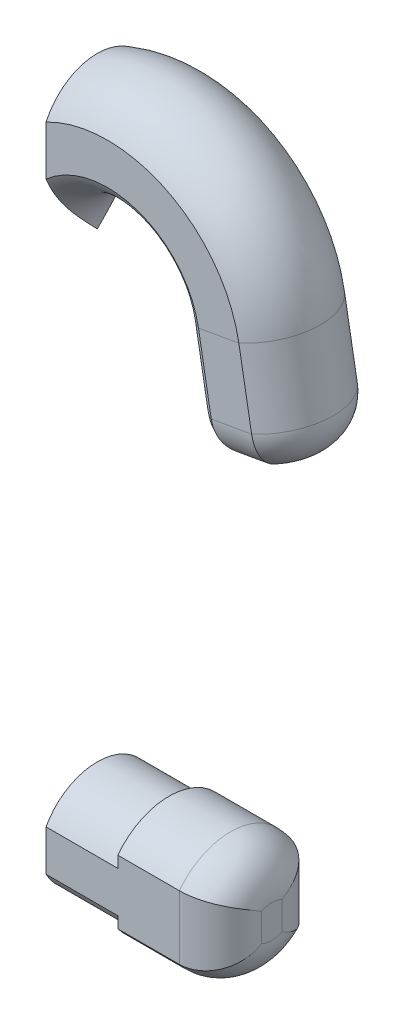
from build123d import *

# Parameters (mm, degrees)
EXTRUDE_1_DEPTH     = 5
SKETCH_19_W         = 5
SKETCH_19_H         = 18
EXTRUDE_2_DEPTH     = 1.5
FILLET_2_R          = 2
SKETCH_20_W         = 13
SKETCH_20_H         = 40
CUT_EXTRUDE_1_DEPTH = 10


with BuildPart() as part:
    # 扫描2: sweep along a path in 草图1
    with BuildLine(Plane.XY) as sweep_2_path:
        Line((11.886241035, 20.455064977), (10.916442642, 25.955064977))
        ThreePointArc((10.916442642, 25.955064977), (5.020643415, 30.47907084), (0, 25))
        Line((0, 25), (0, 0))
        Line((0, 0), (0, -3))
    # 草图13 → 扫描2 (sweep)
    with BuildSketch(Plane(origin=(0, -3, 0), x_dir=(1, 0, 0), z_dir=(0, 1, 0))):
        with BuildLine():
            Line((-1, -2.5), (1, -2.5))
            ThreePointArc((1, -2.5), (2.5, 0), (1, 2.5))
            Line((1, 2.5), (-1, 2.5))
            ThreePointArc((-1, 2.5), (-2.5, 0), (-1, -2.5))
        make_face()
    sweep(path=sweep_2_path.line)

    # 扫描4: sweep along a path in 草图15
    with BuildLine(Plane.XY) as sweep_4_path:
        Line((0, 0), (11, 0))
    # 草图16 → 扫描4 (sweep)
    with BuildSketch(Plane(origin=(11, 0, 0), x_dir=(0, 0, -1), z_dir=(1, 0, 0))):
        with BuildLine():
            Line((-2.5, -1), (-2.5, 1))
            ThreePointArc((-2.5, 1), (0, 2.5), (2.5, 1))
            Line((2.5, 1), (2.5, -1))
            ThreePointArc((2.5, -1), (0, -2.5), (-2.5, -1))
        make_face()
    sweep(path=sweep_4_path.line)

    # 草图17 → 凸台-拉伸1 (add)
    with BuildSketch(Plane(origin=(11, 0, 0), x_dir=(0, 0, -1), z_dir=(1, 0, 0))):
        with BuildLine():
            Line((-2.5, 1.555522876), (-2.5, -1.555522876))
            ThreePointArc((-2.5, -1.555522876), (0, -2.8), (2.5, -1.555522876))
            Line((2.5, -1.555522876), (2.5, 1.555522876))
            ThreePointArc((2.5, 1.555522876), (0, 2.8), (-2.5, 1.555522876))
        make_face()
    extrude(amount=-EXTRUDE_1_DEPTH)

    # 草图19 → 凸台-拉伸2 (add)
    with BuildSketch(Plane(origin=(1, 0, 0), x_dir=(0, 0, -1), z_dir=(1, 0, 0))):
        with Locations((0, 14)):
            Rectangle(SKETCH_19_W, SKETCH_19_H)
    extrude(amount=EXTRUDE_2_DEPTH)

    # 圆角2
    # the kernel refuses this fillet: 2 mm, written as the material it takes off along each edge
    with BuildSketch(Plane(origin=(17.795087554, 21.496954043, 2.5), x_dir=(0, 0, -1), z_dir=(-0.9848077530122092, -0.17364817766692353, 0))) as fillet_2_piece_1:
        with BuildLine():
            CenterArc((FILLET_2_R, -FILLET_2_R), FILLET_2_R, 90, 90)
            Line((0, -FILLET_2_R), (0, 0))
            Line((0, 0), (FILLET_2_R, 0))
        make_face()
    extrude(amount=12, mode=Mode.SUBTRACT)
    with BuildSketch(Plane(origin=(12.214510286, 20.512947703, 0), x_dir=(0.9423506208781961, 0.16616183974819207, -0.2904574845686963), z_dir=(0.2860447827236763, 0.050437412885072544, 0.9568878981667737))) as fillet_2_piece_2:
        with BuildLine():
            CenterArc((2.833333333 - FILLET_2_R, FILLET_2_R), FILLET_2_R, 270, 90)
            Line((2.833333333 - FILLET_2_R, 0), (2.833333333, 0))
            Line((2.833333333, 0), (2.833333333, FILLET_2_R))
        make_face()
    revolve(axis=Axis((12.214510286, 20.512947703, 0), (-0.17364817766692303, 0.9848077530122095, 0)), revolution_arc=326.229306127, mode=Mode.SUBTRACT)
    with BuildSketch(Plane(origin=(5.977394517, 19.413175911, -2.5), x_dir=(-0.17364817766692353, 0.9848077530122094, 0), z_dir=(0.9848077530122092, 0.17364817766692353, 0))) as fillet_2_piece_3:
        with BuildLine():
            CenterArc((FILLET_2_R, FILLET_2_R), FILLET_2_R, 180, 90)
            Line((0, FILLET_2_R), (0, 0))
            Line((0, 0), (FILLET_2_R, 0))
        make_face()
    extrude(amount=12, mode=Mode.SUBTRACT)
    with BuildSketch(Plane(origin=(11, -6.555522876, 2.5), x_dir=(0, 0, -1), z_dir=(0, 1, 0))) as fillet_2_piece_4:
        with BuildLine():
            CenterArc((FILLET_2_R, FILLET_2_R), FILLET_2_R, 180, 90)
            Line((0, FILLET_2_R), (0, 0))
            Line((0, 0), (FILLET_2_R, 0))
        make_face()
    extrude(amount=13.111045751, mode=Mode.SUBTRACT)
    with BuildSketch(Plane(origin=(11, 6.555522876, -2.5), x_dir=(-1, 0, 0), z_dir=(0, -1, 0))) as fillet_2_piece_5:
        with BuildLine():
            CenterArc((FILLET_2_R, -FILLET_2_R), FILLET_2_R, 90, 90)
            Line((0, -FILLET_2_R), (0, 0))
            Line((0, 0), (FILLET_2_R, 0))
        make_face()
    extrude(amount=13.111045751, mode=Mode.SUBTRACT)
    with BuildSketch(Plane(origin=(11, -0.333333333, 0), x_dir=(0, -0.8131785022115455, -0.582014367125922), z_dir=(0, -0.582014367125922, 0.8131785022115455))) as fillet_2_piece_6:
        with BuildLine():
            CenterArc((3.133333333 - FILLET_2_R, -FILLET_2_R), FILLET_2_R, 0, 90)
            Line((3.133333333, -FILLET_2_R), (3.133333333, 0))
            Line((3.133333333, 0), (3.133333333 - FILLET_2_R, 0))
        make_face()
    revolve(axis=Axis((11, -0.333333333, 0), (1, 0, 0)), revolution_arc=288.815304863, mode=Mode.SUBTRACT)
    with BuildSketch(Plane(origin=(11, 0.333333333, 0), x_dir=(0, 0.8131785022115376, 0.5820143671259329), z_dir=(0, 0.5820143671259329, -0.8131785022115376))) as fillet_2_piece_7:
        with BuildLine():
            CenterArc((3.133333333 - FILLET_2_R, -FILLET_2_R), FILLET_2_R, 0, 90)
            Line((3.133333333 - FILLET_2_R, 0), (3.133333333, 0))
            Line((3.133333333, 0), (3.133333333, -FILLET_2_R))
        make_face()
    revolve(axis=Axis((11, 0.333333333, 0), (1, 0, 0)), revolution_arc=288.815304863, mode=Mode.SUBTRACT)
    with BuildSketch(Plane(origin=(11.557971784, 20.397182251, 0), x_dir=(-0.9423506208781962, -0.1661618397481921, 0.2904574845686961), z_dir=(-0.2860447827236761, -0.050437412885072516, -0.9568878981667738))) as fillet_2_piece_8:
        with BuildLine():
            CenterArc((2.833333333 - FILLET_2_R, FILLET_2_R), FILLET_2_R, 270, 90)
            Line((2.833333333, FILLET_2_R), (2.833333333, 0))
            Line((2.833333333, 0), (2.833333333 - FILLET_2_R, 0))
        make_face()
    revolve(axis=Axis((11.557971784, 20.397182251, 0), (-0.17364817766692306, 0.9848077530122095, 0)), revolution_arc=326.229306127, mode=Mode.SUBTRACT)

    # 草图20 → 切除-拉伸1 (cut)
    with BuildSketch(Plane(origin=(2.5, 0, 0), x_dir=(0, 0, -1), z_dir=(1, 0, 0))):
        with Locations((0, 14)):
            Rectangle(SKETCH_20_W, SKETCH_20_H)
    extrude(amount=-CUT_EXTRUDE_1_DEPTH, mode=Mode.SUBTRACT)


with BuildPart() as cut_extrude_1_piece_1:
    # of the separate pieces the step leaves, piece 1, a body of its own (cut_extrude_1_pieces)
    add(part.part.solids().sort_by_distance((10.554136927, 22.251032306, -2.5))[0])


with BuildPart() as cut_extrude_1_piece_2:
    # of the separate pieces the step leaves, piece 2, a body of its own (cut_extrude_1_pieces)
    add(part.part.solids().sort_by_distance((2.5, -1, -2.5))[0])


solid = Compound([cut_extrude_1_piece_1.part, cut_extrude_1_piece_2.part])
